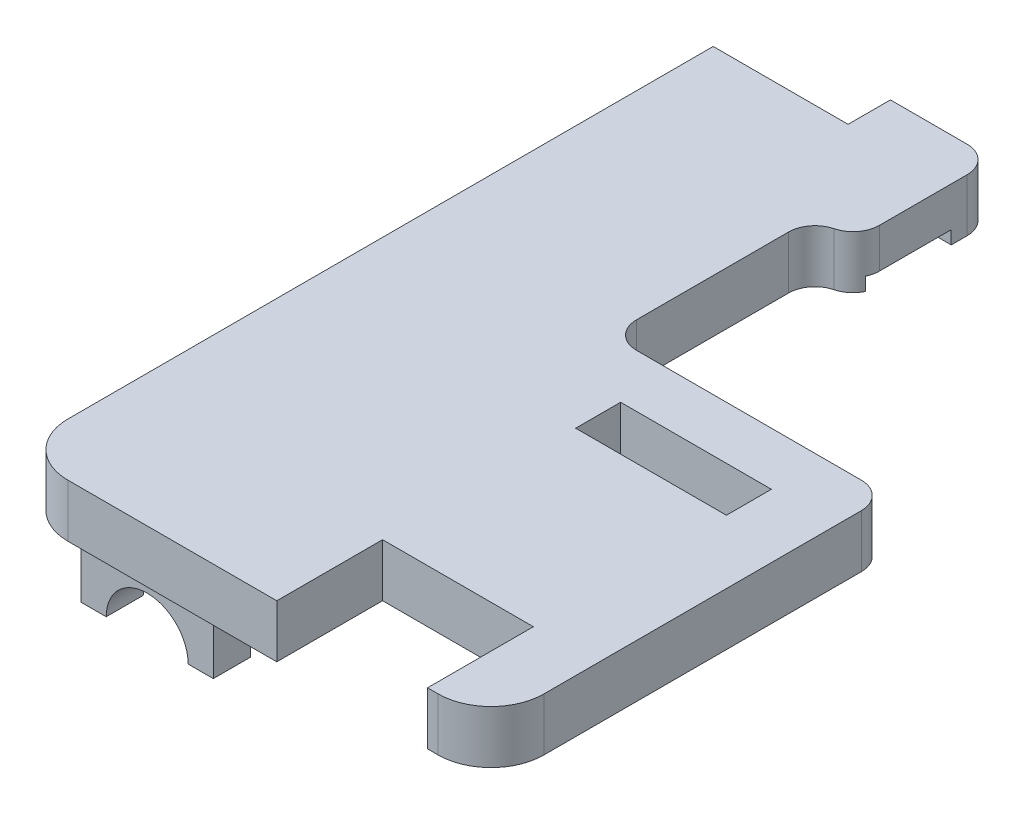
from build123d import *

# Parameters (mm, degrees)
SKETCH1_W               = 18
SKETCH1_H               = 28
BOSS_EXTRUDE1_DEPTH     = 2
SKETCH2_W               = 5
SKETCH2_H               = 1.4
BOSS_EXTRUDE2_DEPTH     = 4.25
CUT_EXTRUDE1_DEPTH      = 34.556854739
CUT_EXTRUDE1_DEPTH_BACK = 34.556854739
SKETCH4_R               = 1.55
FILLET1_R               = 2
SKETCH5_W               = 5.7
SKETCH5_H               = 1.7
SKETCH5_H_2             = 4
SKETCH5_W_2             = 5.1
SKETCH5_H_3             = 1.6
CUT_EXTRUDE2_DEPTH      = 2
CUT_EXTRUDE3_DEPTH      = 34.868311148
CUT_EXTRUDE3_DEPTH_BACK = 34.868311148
FILLET2_R               = 2
SKETCH8_W               = 5.25
SKETCH8_H               = 2
BOSS_EXTRUDE3_DEPTH     = 1.5
FILLET3_R               = 1
FILLET4_R               = 1
SKETCH7_W               = 3.15
SKETCH7_H               = 0.5
CUT_EXTRUDE4_DEPTH      = 34.556854876
BOSS_EXTRUDE4_REACH     = 32.379
BOSS_EXTRUDE6_DEPTH     = 6.45
BOSS_EXTRUDE7_START     = -4.7
BOSS_EXTRUDE7_DEPTH     = 4.7
FILLET7_R               = 2
FILLET8_R               = 1.85


with BuildPart() as part:
    # Sketch1 → Boss-Extrude1 (new body)
    with BuildSketch(Plane(origin=(0, 0, 0), x_dir=(1, 0, 0), z_dir=(0, 1, 0))):
        with Locations((9, 14)):
            Rectangle(SKETCH1_W, SKETCH1_H)
    extrude(amount=BOSS_EXTRUDE1_DEPTH)

    # Sketch2 → Boss-Extrude2 (add)
    with BuildSketch(Plane.XZ):
        with Locations((2.5, -3.2)):
            Rectangle(SKETCH2_W, SKETCH2_H)
        with Locations((2.5, -15.6)):
            Rectangle(SKETCH2_W, SKETCH2_H)
    extrude(amount=BOSS_EXTRUDE2_DEPTH)

    # Sketch4 → Cut-Extrude1 (cut, two sides: drawn at the far end of the back side and taken through both)
    with BuildSketch(Plane.XY.offset(-CUT_EXTRUDE1_DEPTH_BACK)):
        with Locations((2.5, -4.25)):
            Circle(SKETCH4_R)
    extrude(amount=CUT_EXTRUDE1_DEPTH + CUT_EXTRUDE1_DEPTH_BACK, mode=Mode.SUBTRACT)

    # Fillet1
    fillet1_edges = [part.edges().sort_by_distance(p)[0] for p in [
        (0, 1, 0),
    ]]
    fillet(fillet1_edges, radius=FILLET1_R)

    # Sketch5 → Cut-Extrude2 (cut)
    with BuildSketch(Plane(origin=(0, 2, 0), x_dir=(1, 0, 0), z_dir=(0, 1, 0))):
        with Locations((12.75, 12.15)):
            Rectangle(SKETCH5_W, SKETCH5_H)
        with Locations((12.75, 2)):
            Rectangle(SKETCH5_W, SKETCH5_H_2)
        with Locations((2.55, 27.2)):
            Rectangle(SKETCH5_W_2, SKETCH5_H_3)
    extrude(amount=-CUT_EXTRUDE2_DEPTH, mode=Mode.SUBTRACT)

    # Sketch6 → Cut-Extrude3 (cut, two sides: drawn at the far end of the back side and taken through both)
    with BuildSketch(Plane(origin=(0, 2, 0), x_dir=(1, 0, 0), z_dir=(0, 1, 0)).offset(-CUT_EXTRUDE3_DEPTH_BACK)):
        with BuildLine():
            Line((18, 14), (20.5, 14))
            Line((20.5, 14), (20.5, 30.5))
            Line((20.5, 30.5), (7.5, 30.5))
            Line((7.5, 30.5), (7.5, 28))
            Line((7.5, 28), (7.5, 16))
            ThreePointArc((7.5, 16), (7.792893219, 15.292893219), (8.5, 15))
            Line((8.5, 15), (17, 15))
            ThreePointArc((17, 15), (17.707106781, 14.707106781), (18, 14))
        make_face()
    extrude(amount=CUT_EXTRUDE3_DEPTH + CUT_EXTRUDE3_DEPTH_BACK, mode=Mode.SUBTRACT)

    # Fillet2
    fillet2_edges = [part.edges().sort_by_distance(p)[0] for p in [
        (18, 1, 0),
    ]]
    fillet(fillet2_edges, radius=FILLET2_R)

    # Sketch8 → Boss-Extrude3 (add)
    with BuildSketch(Plane(origin=(7.5, 0, 0), x_dir=(0, 0, -1), z_dir=(1, 0, 0))):
        with Locations((25.375, 1)):
            Rectangle(SKETCH8_W, SKETCH8_H)
    extrude(amount=BOSS_EXTRUDE3_DEPTH)

    # Fillet3
    fillet3_edges = [part.edges().sort_by_distance(p)[0] for p in [
        (7.5, 1, -22.75),
        (9, 1, -28),
    ]]
    fillet(fillet3_edges, radius=FILLET3_R)

    # Fillet4
    fillet4_edges = [part.edges().sort_by_distance(p)[0] for p in [
        (9, 1, -22.75),
    ]]
    fillet(fillet4_edges, radius=FILLET4_R)

    # Sketch7 → Cut-Extrude4 (cut, through all)
    with BuildSketch(Plane.ZY):
        with Locations((-24.825, 0.25)):
            Rectangle(SKETCH7_W, SKETCH7_H)
    extrude(amount=-CUT_EXTRUDE4_DEPTH, mode=Mode.SUBTRACT)

    # Sketch9 → Boss-Extrude4 (add, up to next)
    with BuildSketch(Plane(origin=(0, 0, -3.9), x_dir=(-1, 0, 0), z_dir=(0, 0, -1)), mode=Mode.PRIVATE) as boss_extrude4_sk1:
        with BuildLine():
            Line((0, 0), (-1, 0))
            Line((-1, 0), (-1, -0.65))
            ThreePointArc((-1, -0.65), (-0.477127448, -0.915635497), (0, -1.256674091))
            Line((0, -1.256674091), (0, 0))
        make_face()
    boss_extrude4_tool1 = extrude(boss_extrude4_sk1.sketch, amount=BOSS_EXTRUDE4_REACH, mode=Mode.PRIVATE) - part.part
    add(boss_extrude4_tool1.solids().sort_by_distance((0.445326, -0.476066, -3.9))[0])

    # Sketch10 → Boss-Extrude6 (add)
    with BuildSketch(Plane(origin=(0, 0, -16.3), x_dir=(-1, 0, 0), z_dir=(0, 0, -1))):
        with BuildLine():
            Line((-5, -1.5), (-4.075, -2.15))
            ThreePointArc((-4.075, -2.15), (-1.702408348, -1.749105649), (0, -3.44960947))
            Line((0, -3.44960947), (0, 0))
            Line((0, 0), (-5, 0))
            Line((-5, 0), (-5, -1.5))
        make_face()
    extrude(amount=BOSS_EXTRUDE6_DEPTH)

    # Sketch11 → Boss-Extrude7 (add)
    with BuildSketch(Plane(origin=(0, 0, -22.75), x_dir=(-1, 0, 0), z_dir=(0, 0, -1)).offset(BOSS_EXTRUDE7_START)):
        with BuildLine():
            Line((-4.075, -2.15), (-3.184119692, -2.776024))
            ThreePointArc((-3.184119692, -2.776024), (-1.625662965, -2.880270191), (-0.875, -4.25))
            Line((-0.875, -4.25), (0, -4.25))
            Line((0, -4.25), (0, -3.44960947))
            ThreePointArc((0, -3.44960947), (-1.702408348, -1.749105649), (-4.075, -2.15))
        make_face()
    extrude(amount=BOSS_EXTRUDE7_DEPTH)

    # Fillet7
    # the kernel refuses this fillet: 2 mm, written as the material it adds along each edge
    with BuildSketch(Plane(origin=(1, 0, -3.9), x_dir=(1, 0, 0), z_dir=(0, 0, -1))) as fillet7_piece_1:
        with BuildLine():
            CenterArc((1.475635456, 2), FILLET7_R, 222.454150204, 47.545849796)
            Line((0, 0.65), (0, 0))
            Line((0, 0), (1.475635456, 0))
        make_face()
    extrude(amount=14.689088641)

    # Fillet8
    fillet8_edges = [part.edges().sort_by_distance(p)[0] for p in [
        (2.5, 0, -2.5),
    ]]
    fillet(fillet8_edges, radius=FILLET8_R)


solid = part.part
